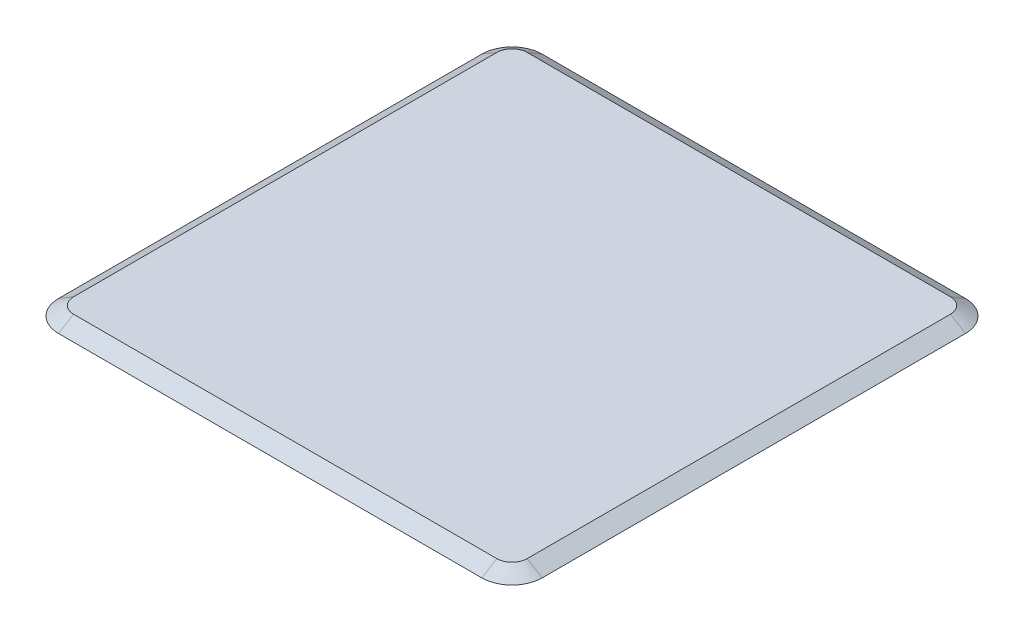
from build123d import *

# Parameters (mm, degrees)
BOSS_EXTRUDE1_DEPTH = 1.5
CHAMFER1_SIZE       = 1.5
CHAMFER1_SIZE_2     = 2.5


with BuildPart() as part:
    # Sketch1 → Boss-Extrude1 (new body)
    with BuildSketch(Plane(origin=(0, 0, 0), x_dir=(1, 0, 0), z_dir=(0, 1, 0))):
        with BuildLine():
            Line((-35, 40), (35, 40))
            ThreePointArc((35, 40), (38.535533906, 38.535533906), (40, 35))
            Line((40, 35), (40, -35))
            ThreePointArc((40, -35), (38.535533906, -38.535533906), (35, -40))
            Line((35, -40), (-35, -40))
            ThreePointArc((-35, -40), (-38.535533906, -38.535533906), (-40, -35))
            Line((-40, -35), (-40, 35))
            ThreePointArc((-40, 35), (-38.535533906, 38.535533906), (-35, 40))
        make_face()
    extrude(amount=BOSS_EXTRUDE1_DEPTH)

    # Chamfer1
    # the kernel refuses this chamfer: 2.5, 1.5 mm, written as the material it takes off along each edge
    with BuildSketch(Plane(origin=(-35, 1.5, 35), x_dir=(0, 0, 1), z_dir=(1, 0, 0))) as chamfer1_piece_1:
        Polygon((5, CHAMFER1_SIZE), (5 - CHAMFER1_SIZE_2, 0), (5, 0), align=None)
    revolve(axis=Axis((-35, 1.5, 35), (0, -1, 0)), revolution_arc=90, mode=Mode.SUBTRACT)
    with BuildSketch(Plane(origin=(-40, 1.5, 35), x_dir=(-0.05518620705976808, -0.9984760801092615, 0), z_dir=(0, 0, -1)), Plane(origin=(-35, 1.5, -40), x_dir=(0, -0.9984760801092615, -0.05518620705976808), z_dir=(1, 0, 0)), Plane(origin=(35, 1.5, 40), x_dir=(0, -0.9984760801092615, 0.05518620705976808), z_dir=(-1, 0, 0)), Plane(origin=(40, 1.5, -35), x_dir=(0.05518620705976808, -0.9984760801092615, 0), z_dir=(0, 0, 1))) as chamfer1_piece_2:
        Polygon((CHAMFER1_SIZE * 0.998476080109, -CHAMFER1_SIZE * 0.0551862070598), (-CHAMFER1_SIZE_2 * 0.0551862070598, -CHAMFER1_SIZE_2 * 0.998476080109), (0, 0), align=None)
    extrude(amount=70, mode=Mode.SUBTRACT)
    with BuildSketch(Plane(origin=(-35, 1.5, -35), x_dir=(-1, 0, 0), z_dir=(0, 0, 1))) as chamfer1_piece_3:
        Polygon((5, CHAMFER1_SIZE), (5 - CHAMFER1_SIZE_2, 0), (5, 0), align=None)
    revolve(axis=Axis((-35, 1.5, -35), (0, -1, 0)), revolution_arc=90, mode=Mode.SUBTRACT)
    with BuildSketch(Plane(origin=(35, 1.5, -35), x_dir=(0, 0, -1), z_dir=(-1, 0, 0))) as chamfer1_piece_4:
        Polygon((5, CHAMFER1_SIZE), (5 - CHAMFER1_SIZE_2, 0), (5, 0), align=None)
    revolve(axis=Axis((35, 1.5, -35), (0, -1, 0)), revolution_arc=90, mode=Mode.SUBTRACT)
    with BuildSketch(Plane(origin=(35, 1.5, 35), x_dir=(1, 0, 0), z_dir=(0, 0, -1))) as chamfer1_piece_5:
        Polygon((5, CHAMFER1_SIZE), (5 - CHAMFER1_SIZE_2, 0), (5, 0), align=None)
    revolve(axis=Axis((35, 1.5, 35), (0, -1, 0)), revolution_arc=90, mode=Mode.SUBTRACT)


solid = part.part
